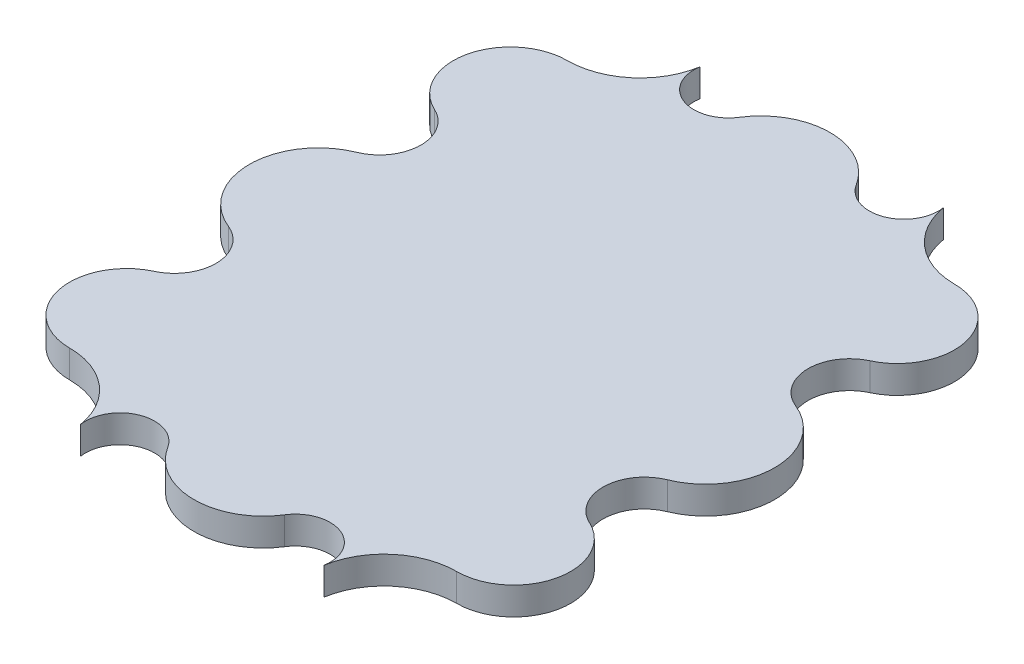
from build123d import *

# Parameters (mm, degrees)
SALIENTE_EXTRUIR1_DEPTH = 10
SALIENTE_EXTRUIR2_DEPTH = 10


with BuildPart() as part:
    # Croquis1 → Saliente-Extruir1 (new body)
    with BuildSketch(Plane(origin=(0, 0, 0), x_dir=(1, 0, 0), z_dir=(0, 1, 0))):
        with BuildLine():
            Line((-70, -90), (-70, 90))
            ThreePointArc((-70, 90), (-52.983030462, 96.249658661), (-44.055908755, 112.027554074))
            ThreePointArc((-44.055908755, 112.027554074), (-36.156795126, 98.313355526), (-21.147629234, 103.333333333))
            ThreePointArc((-21.147629234, 103.333333333), (0, 115), (21.147629234, 103.333333333))
            ThreePointArc((21.147629234, 103.333333333), (36.156795126, 98.313355526), (44.055908755, 112.027554074))
            ThreePointArc((44.055908755, 112.027554074), (52.983030462, 96.249658661), (70, 90))
            Line((70, 90), (70, -90))
            ThreePointArc((70, -90), (52.983030462, -96.249658661), (44.055908755, -112.027554074))
            ThreePointArc((44.055908755, -112.027554074), (36.156795126, -98.313355526), (21.147629234, -103.333333333))
            ThreePointArc((21.147629234, -103.333333333), (0, -115), (-21.147629234, -103.333333333))
            ThreePointArc((-21.147629234, -103.333333333), (-36.156795126, -98.313355526), (-44.055908755, -112.027554074))
            ThreePointArc((-44.055908755, -112.027554074), (-52.983030462, -96.249658661), (-70, -90))
        make_face()
    extrude(amount=SALIENTE_EXTRUIR1_DEPTH)

    # Croquis2 → Saliente-Extruir2 (add)
    with BuildSketch(Plane(origin=(0, 10, 0), x_dir=(1, 0, 0), z_dir=(0, 1, 0))):
        with BuildLine():
            ThreePointArc((78.682594762, 50.68578538), (90.130790614, 73.830022537), (70, 90))
            Line((70, 90), (70, 37.080992462))
            ThreePointArc((70, 37.080992462), (72.355612347, 45.150655433), (78.682594762, 50.68578538))
        make_face()
        with BuildLine():
            ThreePointArc((78.682594762, -50.68578538), (72.355612347, -45.150655433), (70, -37.080992462))
            Line((70, -37.080992462), (70, -90))
            ThreePointArc((70, -90), (90.130790614, -73.830022537), (78.682594762, -50.68578538))
        make_face()
        with BuildLine():
            ThreePointArc((79.375, 23.175620272), (72.562657029, 28.695737531), (70, 37.080992462))
            Line((70, 37.080992462), (70, -37.080992462))
            ThreePointArc((70, -37.080992462), (72.562657029, -28.695737531), (79.375, -23.175620272))
            ThreePointArc((79.375, -23.175620272), (95, 0), (79.375, 23.175620272))
        make_face()
        with BuildLine():
            Line((-70, -90), (-70, -37.080992462))
            ThreePointArc((-70, -37.080992462), (-72.355612347, -45.150655433), (-78.682594762, -50.68578538))
            ThreePointArc((-78.682594762, -50.68578538), (-90.130790614, -73.830022537), (-70, -90))
        make_face()
        with BuildLine():
            Line((-70, -37.080992462), (-70, 37.080992435))
            ThreePointArc((-70, 37.080992435), (-72.562657036, 28.69573752), (-79.375, 23.175620272))
            ThreePointArc((-79.375, 23.175620272), (-95, 0), (-79.375, -23.175620272))
            ThreePointArc((-79.375, -23.175620272), (-72.562657029, -28.695737531), (-70, -37.080992462))
        make_face()
        with BuildLine():
            Line((-70, 37.080992435), (-70, 90))
            ThreePointArc((-70, 90), (-90.130790614, 73.830022537), (-78.682594762, 50.68578538))
            ThreePointArc((-78.682594762, 50.68578538), (-72.35561234, 45.150655422), (-70, 37.080992435))
        make_face()
    extrude(amount=-SALIENTE_EXTRUIR2_DEPTH)


solid = part.part
